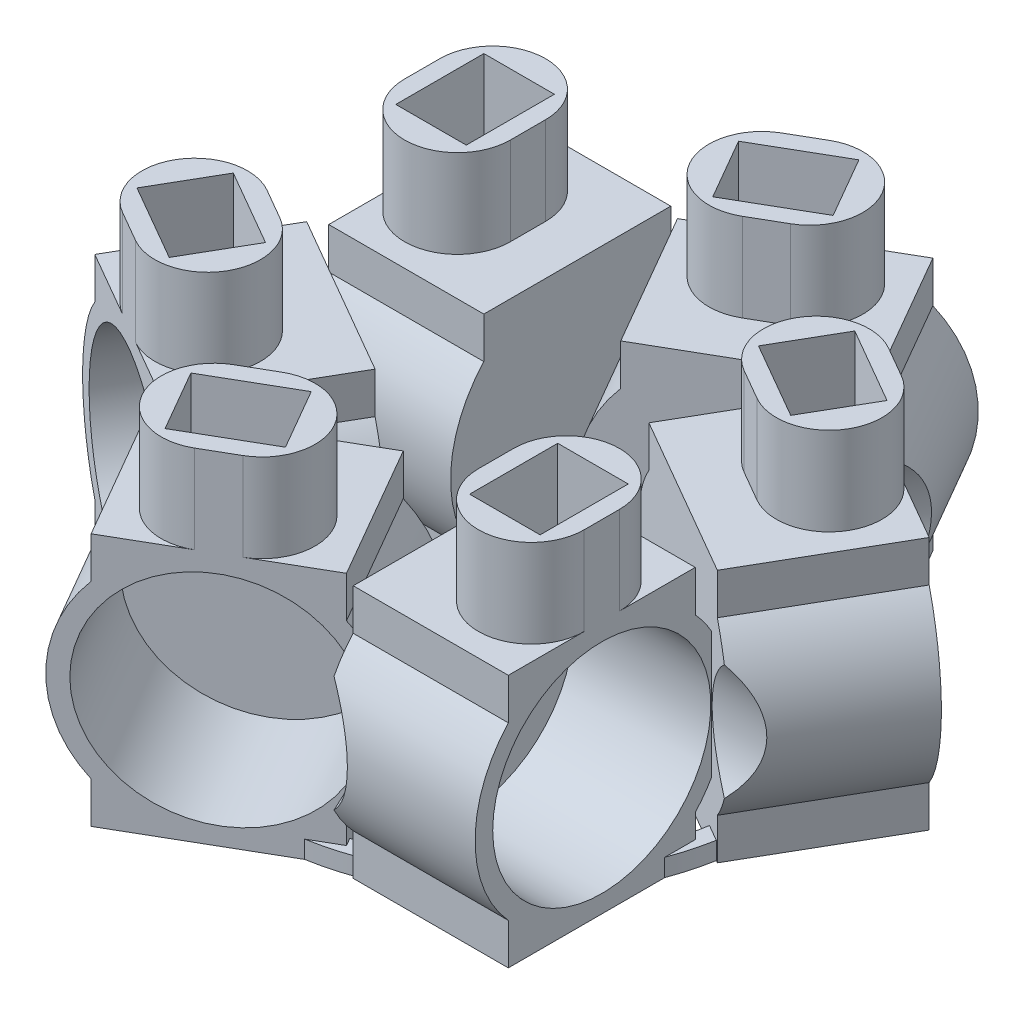
from build123d import *

# Parameters (mm, degrees)
SKETCH1_R                = 35.95
BOSS_EXTRUDE1_DEPTH      = 55.5
SHELL1_T                 = -5
BOSS_EXTRUDE2_REACH      = 99.685
BOSS_EXTRUDE2_END_RADIUS = 35.95
SKETCH2_W                = 111
SKETCH2_H                = 53.04
CUT_EXTRUDE1_REACH       = 99.685
CUT_EXTRUDE1_END_RADIUS  = 30.95
SKETCH3_W                = 20
SKETCH3_H                = 25
BOSS_EXTRUDE5_DEPTH      = 25
CUT_EXTRUDE2_REACH       = 119.313
SKETCH6_W                = 20
SKETCH6_H                = 25
CUT_EXTRUDE3_DEPTH       = 98.684504912
CUT_EXTRUDE3_DEPTH_BACK  = 98.684504912
SKETCH7_W                = 67
SKETCH7_H                = 71.9
SKETCH8_R                = 72.5
SKETCH8_R_2              = 67.5
EXTRUDE_THIN1_DEPTH      = 5
CIRPATTERN1_COUNT        = 6
SKETCH9_R                = 30.95
CUT_EXTRUDE4_DEPTH       = 202.992862618
CIRPATTERN4_COUNT        = 6


with BuildPart() as part:
    # Sketch1 → Boss-Extrude1 (new, symmetric)
    with BuildSketch(Plane(origin=(0, 0, 0), x_dir=(0, 0, -1), z_dir=(1, 0, 0))):
        Circle(SKETCH1_R)
    extrude(amount=BOSS_EXTRUDE1_DEPTH, both=True)

    # Shell1
    shell1_openings = [part.faces().sort_by_distance(p)[0] for p in [
        (55.5, 0, 0),
    ]]
    offset(amount=SHELL1_T, openings=shell1_openings, kind=Kind.INTERSECTION)

    # Boss-Extrude2: up to this cylinder (the profile starts outside it)
    boss_extrude2_end = Plane(origin=(0, 0, 0), z_dir=(-1, 0, 0)) * Cylinder(BOSS_EXTRUDE2_END_RADIUS, 272.27, mode=Mode.PRIVATE)
    # Sketch2 → Boss-Extrude2 (add, up to the surface)
    with BuildSketch(Plane(origin=(0, 35.95, 0), x_dir=(1, 0, 0), z_dir=(0, 1, 0)), mode=Mode.PRIVATE) as boss_extrude2_sk1:
        Rectangle(SKETCH2_W, SKETCH2_H)
    boss_extrude2_tool1 = extrude(boss_extrude2_sk1.sketch, amount=-BOSS_EXTRUDE2_REACH, mode=Mode.PRIVATE) - boss_extrude2_end
    boss_extrude2 = boss_extrude2_tool1.solids().sort_by_distance((0, 35.95, 0))[0] + boss_extrude2_tool1.solids().sort_by_distance((0, 35.95, 0))[1]
    add(boss_extrude2)

    # Mirror1: Boss-Extrude2 across plane
    add(boss_extrude2.mirror(Plane.ZX))

    # Cut-Extrude1: up to this cylinder (the profile starts outside it)
    cut_extrude1_end = Plane(origin=(-26.5, 0, 0), z_dir=(-1, 0, 0)) * Cylinder(CUT_EXTRUDE1_END_RADIUS, 262.27, mode=Mode.PRIVATE)
    # Sketch3 → Cut-Extrude1 (cut, up to the surface)
    with BuildSketch(Plane(origin=(0, 35.95, 0), x_dir=(1, 0, 0), z_dir=(0, 1, 0)), mode=Mode.PRIVATE) as cut_extrude1_sk1:
        with Locations((-26.5, 0)):
            Rectangle(SKETCH3_W, SKETCH3_H)
    cut_extrude1_tool1 = extrude(cut_extrude1_sk1.sketch, amount=-CUT_EXTRUDE1_REACH, mode=Mode.PRIVATE) - cut_extrude1_end
    add(cut_extrude1_tool1.solids().sort_by_distance((-26.5, 35.95, 0))[0], mode=Mode.SUBTRACT)

    # Sketch5 → Boss-Extrude5 (add)
    with BuildSketch(Plane(origin=(0, 35.95, 0), x_dir=(1, 0, 0), z_dir=(0, 1, 0))):
        with BuildLine():
            Line((-11.5, 5), (-11.5, -5))
            ThreePointArc((-11.5, -5), (-26.5, -20), (-41.5, -5))
            Line((-41.5, -5), (-41.5, 5))
            ThreePointArc((-41.5, 5), (-26.5, 20), (-11.5, 5))
        make_face()
    extrude(amount=BOSS_EXTRUDE5_DEPTH)

    # Sketch6 → Cut-Extrude2 (cut, up to next)
    with BuildSketch(Plane(origin=(0, 60.95, 0), x_dir=(1, 0, 0), z_dir=(0, 1, 0)), mode=Mode.PRIVATE) as cut_extrude2_sk1:
        with Locations((-26.5, 0)):
            Rectangle(SKETCH6_W, SKETCH6_H)
    cut_extrude2_tool1 = extrude(cut_extrude2_sk1.sketch, amount=-CUT_EXTRUDE2_REACH, mode=Mode.PRIVATE) & part.part
    add(cut_extrude2_tool1.solids().sort_by_distance((-26.5, 60.95, 0))[0], mode=Mode.SUBTRACT)

    # Sketch7 → Cut-Extrude3 (cut, two sides: drawn at the far end of the back side and taken through both)
    with BuildSketch(Plane(origin=(0, 35.95, 0), x_dir=(1, 0, 0), z_dir=(0, 1, 0)).offset(-CUT_EXTRUDE3_DEPTH_BACK)):
        with Locations((22, 0)):
            Rectangle(SKETCH7_W, SKETCH7_H)
    extrude(amount=CUT_EXTRUDE3_DEPTH + CUT_EXTRUDE3_DEPTH_BACK, mode=Mode.SUBTRACT)

    # Sketch8 → Extrude-Thin1 (add)
    with BuildSketch(Plane(origin=(0, -35.95, 0), x_dir=(1, 0, 0), z_dir=(0, 1, 0))):
        with Locations((-79.617651648, 42.644066919)):
            Circle(SKETCH8_R)
        with Locations((-79.617651648, 42.644066919)):
            Circle(SKETCH8_R_2, mode=Mode.SUBTRACT)
    extrude(amount=EXTRUDE_THIN1_DEPTH)


with BuildPart() as cirpattern1_1:
    # CirPattern1: pattern copy
    add(part.part.rotate(Axis((-79.617651648, 0, -42.644066919), (0, 1, 0)), 1 * 360 / CIRPATTERN1_COUNT))

    # Sketch9 → Cut-Extrude4 (cut, through all)
    with BuildSketch(Plane(origin=(-50.5, 0, 0), x_dir=(0, 0, -1), z_dir=(1, 0, 0))):
        with Locations(Location((0, 0, 0), (0, 0, 180))):
            Circle(SKETCH9_R)
    cut_extrude4 = extrude(amount=CUT_EXTRUDE4_DEPTH, mode=Mode.SUBTRACT)


with BuildPart() as cirpattern1_2:
    # CirPattern1: pattern copy
    add(part.part.rotate(Axis((-79.617651648, 0, -42.644066919), (0, 1, 0)), 2 * 360 / CIRPATTERN1_COUNT))


with BuildPart() as cirpattern1_3:
    # CirPattern1: pattern copy
    add(part.part.rotate(Axis((-79.617651648, 0, -42.644066919), (0, 1, 0)), 3 * 360 / CIRPATTERN1_COUNT))


with BuildPart() as cirpattern1_4:
    # CirPattern1: pattern copy
    add(part.part.rotate(Axis((-79.617651648, 0, -42.644066919), (0, 1, 0)), 4 * 360 / CIRPATTERN1_COUNT))


with BuildPart() as cirpattern1_5:
    # CirPattern1: pattern copy
    add(part.part.rotate(Axis((-79.617651648, 0, -42.644066919), (0, 1, 0)), 5 * 360 / CIRPATTERN1_COUNT))

    # Combine1: read off the stored shape, not the designer's step
    # Combine1: union CirPattern1_3, part, CirPattern1_2, CirPattern1_4, CirPattern1_1
    add(cirpattern1_3.part)
    add(part.part)
    add(cirpattern1_2.part)
    add(cirpattern1_4.part)
    add(cirpattern1_1.part)

    # CirPattern4: Cut-Extrude4 ×6 about axis
    cirpattern4_axis = Axis((-79.617651648, 0, -42.644066919), (0, -1, 0))
    for i in range(1, CIRPATTERN4_COUNT):
        add(cut_extrude4.rotate(cirpattern4_axis, i * 360 / CIRPATTERN4_COUNT), mode=Mode.SUBTRACT)


solid = cirpattern1_5.part
